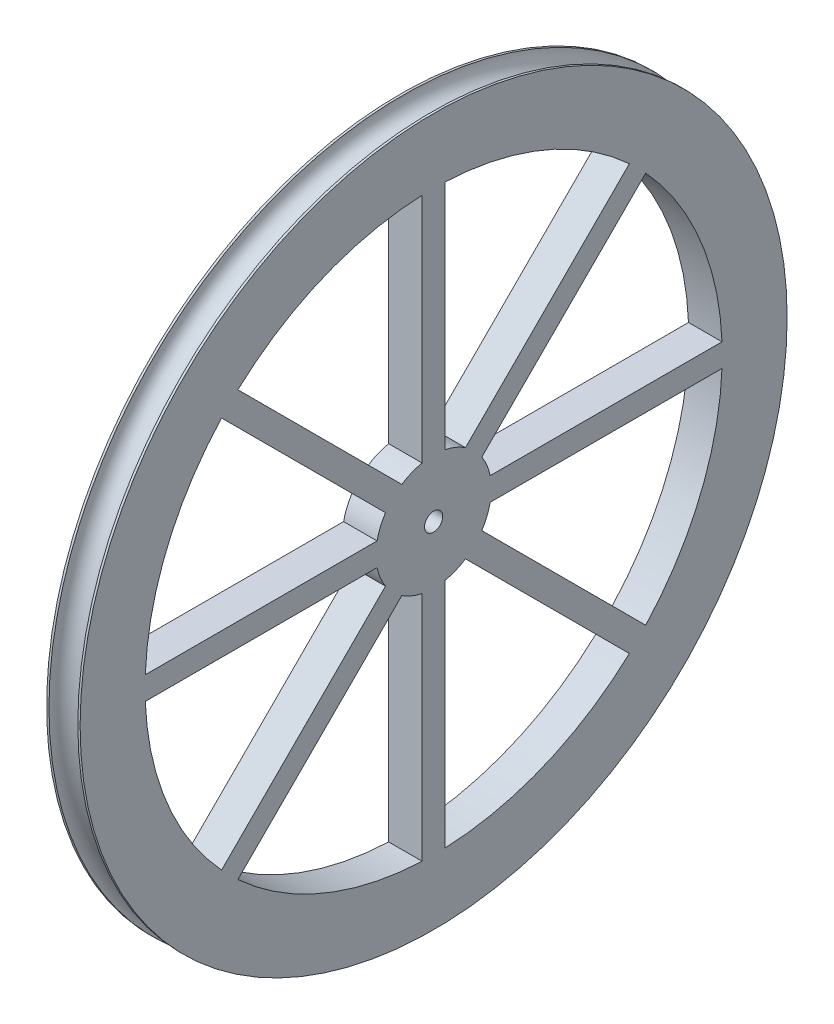
from build123d import *

# Parameters (mm, degrees)
SKETCH1_R           = 38.89375
BOSS_EXTRUDE1_DEPTH = 3.683
SKETCH10_R          = 1.5875
CUT_EXTRUDE3_DEPTH  = 56.127235257
SKETCH12_R          = 0.999998
CUT_EXTRUDE4_DEPTH  = 56.127235257


with BuildPart() as part:
    # Sketch1 → Boss-Extrude1 (new body)
    with BuildSketch(Plane(origin=(0, 0, 0), x_dir=(0, 0, -1), z_dir=(1, 0, 0))):
        Circle(SKETCH1_R)
    extrude(amount=BOSS_EXTRUDE1_DEPTH)

    # Sketch10 → Cut-Revolve1 (revolve, cut)
    with BuildSketch(Plane.XY):
        with Locations((1.8415, 38.89375)):
            Circle(SKETCH10_R)
    revolve(axis=Axis((-1.01619145, 0, 0), (1, 0, 0)), mode=Mode.SUBTRACT)

    # Sketch11 → Cut-Extrude3 (cut, through all)
    with BuildSketch(Plane(origin=(3.683, 0, 0), x_dir=(0, 0, -1), z_dir=(1, 0, 0))):
        with BuildLine():
            Line((-1.27, 31.724589832), (-1.27, 6.221703947))
            ThreePointArc((-1.27, 6.221703947), (-2.430039796, 5.866635031), (-3.501383439, 5.297434663))
            Line((-3.501383439, 5.297434663), (-21.534646988, 23.330698213))
            ThreePointArc((-21.534646988, 23.330698213), (-12.150198978, 29.333175157), (-1.27, 31.724589832))
        make_face()
        with BuildLine():
            Line((1.27, 31.724589832), (1.27, 6.221703947))
            ThreePointArc((1.27, 6.221703947), (2.430039796, 5.866635031), (3.501383439, 5.297434663))
            Line((3.501383439, 5.297434663), (21.534646988, 23.330698213))
            ThreePointArc((21.534646988, 23.330698213), (12.150198978, 29.333175157), (1.27, 31.724589832))
        make_face()
        with BuildLine():
            Line((23.330698213, 21.534646988), (5.297434663, 3.501383439))
            ThreePointArc((5.297434663, 3.501383439), (5.866635031, 2.430039796), (6.221703947, 1.27))
            Line((6.221703947, 1.27), (31.724589832, 1.27))
            ThreePointArc((31.724589832, 1.27), (29.333175157, 12.150198978), (23.330698213, 21.534646988))
        make_face()
        with BuildLine():
            Line((31.724589832, -1.27), (6.221703947, -1.27))
            ThreePointArc((6.221703947, -1.27), (5.866635031, -2.430039796), (5.297434663, -3.501383439))
            Line((5.297434663, -3.501383439), (23.330698213, -21.534646988))
            ThreePointArc((23.330698213, -21.534646988), (29.333175157, -12.150198978), (31.724589832, -1.27))
        make_face()
        with BuildLine():
            Line((21.534646988, -23.330698213), (3.501383439, -5.297434663))
            ThreePointArc((3.501383439, -5.297434663), (2.430039796, -5.866635031), (1.27, -6.221703947))
            Line((1.27, -6.221703947), (1.27, -31.724589832))
            ThreePointArc((1.27, -31.724589832), (12.150198978, -29.333175157), (21.534646988, -23.330698213))
        make_face()
        with BuildLine():
            Line((-1.27, -31.724589832), (-1.27, -6.221703947))
            ThreePointArc((-1.27, -6.221703947), (-2.430039796, -5.866635031), (-3.501383439, -5.297434663))
            Line((-3.501383439, -5.297434663), (-21.534646988, -23.330698213))
            ThreePointArc((-21.534646988, -23.330698213), (-12.150198978, -29.333175157), (-1.27, -31.724589832))
        make_face()
        with BuildLine():
            Line((-23.330698213, -21.534646988), (-5.297434663, -3.501383439))
            ThreePointArc((-5.297434663, -3.501383439), (-5.866635031, -2.430039796), (-6.221703947, -1.27))
            Line((-6.221703947, -1.27), (-31.724589832, -1.27))
            ThreePointArc((-31.724589832, -1.27), (-29.333175157, -12.150198978), (-23.330698213, -21.534646988))
        make_face()
        with BuildLine():
            Line((-31.724589832, 1.27), (-6.221703947, 1.27))
            ThreePointArc((-6.221703947, 1.27), (-5.866635031, 2.430039796), (-5.297434663, 3.501383439))
            Line((-5.297434663, 3.501383439), (-23.330698213, 21.534646988))
            ThreePointArc((-23.330698213, 21.534646988), (-29.333175157, 12.150198978), (-31.724589832, 1.27))
        make_face()
    extrude(amount=-CUT_EXTRUDE3_DEPTH, mode=Mode.SUBTRACT)

    # Sketch12 → Cut-Extrude4 (cut, through all)
    with BuildSketch(Plane(origin=(3.683, 0, 0), x_dir=(0, 0, -1), z_dir=(1, 0, 0))):
        Circle(SKETCH12_R)
    extrude(amount=-CUT_EXTRUDE4_DEPTH, mode=Mode.SUBTRACT)


solid = part.part
